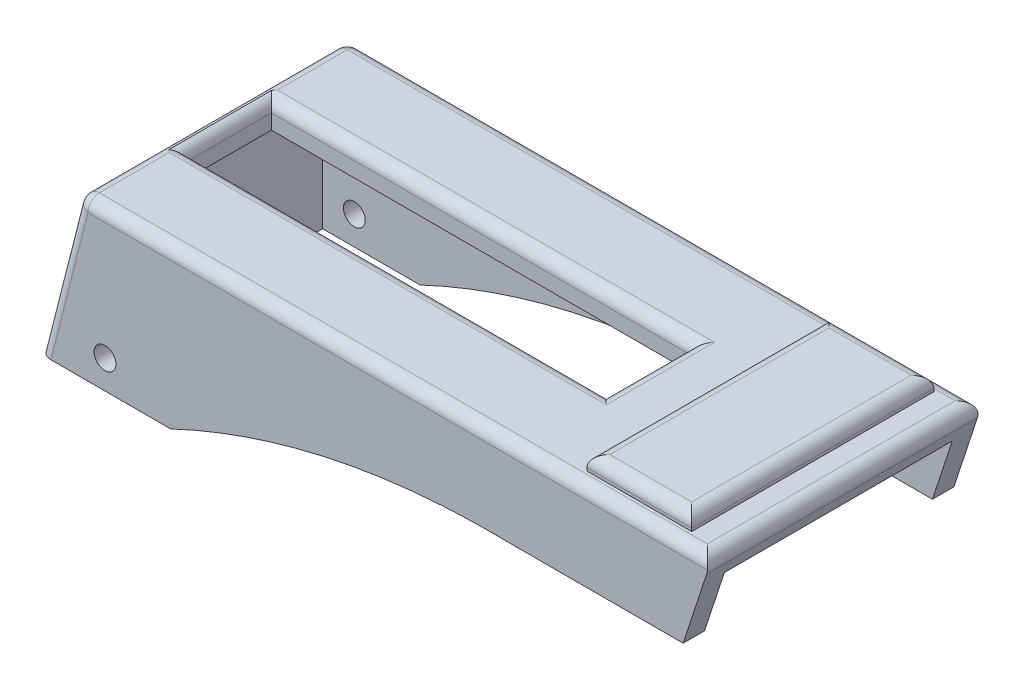
from build123d import *

# Parameters (mm, degrees)
SKETCH5_W           = 53.848
SKETCH5_H           = 14.0335
SKETCH5_W_2         = 9.3472
SKETCH5_H_2         = 1.27
BOSS_EXTRUDE2_DEPTH = 24.13
SKETCH7_R           = 0.97155
CUT_EXTRUDE3_DEPTH  = 40.748679545
SKETCH8_W           = 9.3472
SKETCH8_H           = 1.27
CUT_EXTRUDE4_DEPTH  = 1.27
SKETCH9_W           = 37.465
SKETCH9_H           = 7.62
CUT_EXTRUDE5_DEPTH  = 42.33069605
SKETCH10_W          = 56.896
SKETCH10_H          = 20.32
CUT_EXTRUDE6_DEPTH  = 11.684
FILLET1_R           = 1.016
FILLET5_R           = 1.016


with BuildPart() as part:
    # Sketch5 → Boss-Extrude2 (new body)
    with BuildSketch(Plane.XY):
        Rectangle(SKETCH5_W, SKETCH5_H)
        Polygon((26.924, 7.01675), (26.924, -0.71755), (29.464, 7.01675), align=None)
        Polygon((-26.924, 7.01675), (-30.48, -7.01675), (-26.924, -7.01675), align=None)
        with Locations((21.7424, 7.65175)):
            Rectangle(SKETCH5_W_2, SKETCH5_H_2)
    extrude(amount=BOSS_EXTRUDE2_DEPTH)

    # Sketch7 → Cut-Extrude3 (cut, through all)
    with BuildSketch(Plane.XY.offset(24.13)):
        with BuildLine():
            Line((26.924, -7.01675), (26.924, -0.71755))
            Line((26.924, -0.71755), (8.862620223, -0.71755))
            add(Edge.make_bspline(
                [(-18.7706, -7.01675), (-5.778401918, -0.891302623), (8.862620223, -0.71755)],
                knots=[0, 0, 0, 1, 1, 1], degree=2))
            Line((-18.7706, -7.01675), (26.924, -7.01675))
        make_face()
        with Locations((-24.6126, -4.47675)):
            Circle(SKETCH7_R)
    extrude(amount=-CUT_EXTRUDE3_DEPTH, mode=Mode.SUBTRACT)

    # Sketch8 → Cut-Extrude4 (cut)
    with BuildSketch(Plane(origin=(0, 8.28675, 0), x_dir=(1, 0, 0), z_dir=(0, 1, 0))):
        with Locations((21.7424, -0.635)):
            Rectangle(SKETCH8_W, SKETCH8_H)
        with Locations((21.7424, -23.495)):
            Rectangle(SKETCH8_W, SKETCH8_H)
    extrude(amount=-CUT_EXTRUDE4_DEPTH, mode=Mode.SUBTRACT)

    # Sketch9 → Cut-Extrude5 (cut, through all)
    with BuildSketch(Plane(origin=(0, 7.01675, 0), x_dir=(1, 0, 0), z_dir=(0, 1, 0))):
        with Locations((-6.9215, -12.065)):
            Rectangle(SKETCH9_W, SKETCH9_H)
    extrude(amount=-CUT_EXTRUDE5_DEPTH, mode=Mode.SUBTRACT)

    # Sketch10 → Cut-Extrude6 (cut)
    with BuildSketch(Plane.XZ.offset(7.01675)):
        with Locations((1.016, 12.065)):
            Rectangle(SKETCH10_W, SKETCH10_H)
    extrude(amount=-CUT_EXTRUDE6_DEPTH, mode=Mode.SUBTRACT)

    # Fillet1
    # the kernel refuses this fillet: 1.016 mm, written as the material it takes off along each edge
    with BuildSketch(Plane(origin=(-26.133337543, 6.00075, 1.016), x_dir=(-0.9693635135141576, 0.2456305735601486, 0), z_dir=(0, 0, -1))) as fillet1_piece_1_section:
        Polygon((0, 0), (FILLET1_R, 0), (FILLET1_R, FILLET1_R * 0.778211079665), (FILLET1_R * 0.24563057356, FILLET1_R * 0.969363513514), align=None)
    fillet1_piece_1 = extrude(amount=FILLET1_R, mode=Mode.PRIVATE)
    fillet1_piece_1 = fillet1_piece_1 - Plane(origin=(-26.133337543, 6.00075, 1.016), x_dir=(0.6141536560339975, -0.7891864714882498, 0), z_dir=(0, 0, -1)) * Sphere(FILLET1_R, mode=Mode.PRIVATE)
    add(fillet1_piece_1, mode=Mode.SUBTRACT)
    with BuildSketch(Plane(origin=(-26.133337543, 6.00075, 23.114), x_dir=(-0.9693635135141576, 0.2456305735601486, 0), z_dir=(0, 0, 1))) as fillet1_piece_2_section:
        Polygon((0, 0), (FILLET1_R, 0), (FILLET1_R, -FILLET1_R * 0.778211079665), (FILLET1_R * 0.24563057356, -FILLET1_R * 0.969363513514), align=None)
    fillet1_piece_2 = extrude(amount=FILLET1_R, mode=Mode.PRIVATE)
    fillet1_piece_2 = fillet1_piece_2 - Plane(origin=(-26.133337543, 6.00075, 23.114), x_dir=(0.6141536560339975, -0.7891864714882498, 0), z_dir=(0, 0, 1)) * Sphere(FILLET1_R, mode=Mode.PRIVATE)
    add(fillet1_piece_2, mode=Mode.SUBTRACT)
    with BuildSketch(Plane(origin=(-26.924, 7.01675, 1.016), x_dir=(-0.24563057356014745, -0.969363513514158, 0), z_dir=(0, 0, 1))) as fillet1_piece_3:
        with BuildLine():
            CenterArc((FILLET1_R * 0.778211079665, FILLET1_R), FILLET1_R, 194.219101718, 75.780898282)
            Line((-FILLET1_R * 0.191152433849, FILLET1_R * 0.75436942644), (0, 0))
            Line((0, 0), (FILLET1_R * 0.778211079665, 0))
        make_face()
    extrude(amount=22.098, mode=Mode.SUBTRACT)
    with BuildSketch(Plane(origin=(29.464, 7.01675, -3.507619048), x_dir=(-0.312012480499221, -0.9500780031201245, 0), z_dir=(0, 0, 1))) as fillet1_piece_4:
        with BuildLine():
            CenterArc((FILLET1_R * 1.38095238095, -FILLET1_R), FILLET1_R, 90, 108.180553842)
            Line((FILLET1_R * 0.430874377832, -FILLET1_R * 1.3120124805), (0, 0))
            Line((0, 0), (FILLET1_R * 1.38095238095, 0))
        make_face()
    extrude(amount=31.145238095, mode=Mode.SUBTRACT)
    with BuildSketch(Plane(origin=(32.004, 7.01675, 24.13), x_dir=(0, -1, 0), z_dir=(-1, 0, 0)), Plane(origin=(-26.133337543, 7.01675, 0), x_dir=(0, -1, 0), z_dir=(1, 0, 0))) as fillet1_piece_5:
        with BuildLine():
            CenterArc((FILLET1_R, -FILLET1_R), FILLET1_R, 90, 90)
            Line((0, -FILLET1_R), (0, 0))
            Line((0, 0), (FILLET1_R, 0))
        make_face()
    extrude(amount=58.137337543, mode=Mode.SUBTRACT)
    with BuildSketch(Plane(origin=(-27.118210873, 6.250310663, 24.13), x_dir=(0.9693635135141576, -0.24563057356014859, -3.4967654318902577e-15), z_dir=(-0.2456305735601486, -0.9693635135141576, 0)), Plane(origin=(-27.118210873, 6.250310663, 0), x_dir=(0, 0, 1), z_dir=(-0.2456305735601486, -0.9693635135141576, 0))) as fillet1_piece_6:
        with BuildLine():
            CenterArc((FILLET1_R, -FILLET1_R), FILLET1_R, 90, 90)
            Line((0, -FILLET1_R), (0, 0))
            Line((0, 0), (FILLET1_R, 0))
        make_face()
    extrude(amount=16.22636273, mode=Mode.SUBTRACT)
    with BuildSketch(Plane(origin=(11.811, 7.01675, 15.875), x_dir=(1, 0, 0), z_dir=(0, 0, -1)), Plane(origin=(-25.654, 7.01675, 8.255), x_dir=(-1, 0, 0), z_dir=(0, 0, 1))) as fillet1_piece_7:
        with BuildLine():
            CenterArc((FILLET1_R, FILLET1_R), FILLET1_R, 180, 90)
            Line((0, FILLET1_R), (0, 0))
            Line((0, 0), (FILLET1_R, 0))
        make_face()
    extrude(amount=7.62, mode=Mode.SUBTRACT)
    with BuildSketch(Plane(origin=(11.811, 7.01675, 8.255), x_dir=(0, 0, -1), z_dir=(-1, 0, 0)), Plane(origin=(-25.654, 7.01675, 15.875), x_dir=(0, 0, 1), z_dir=(1, 0, 0))) as fillet1_piece_8:
        with BuildLine():
            CenterArc((FILLET1_R, FILLET1_R), FILLET1_R, 180, 90)
            Line((0, FILLET1_R), (0, 0))
            Line((0, 0), (FILLET1_R, 0))
        make_face()
    extrude(amount=37.465, mode=Mode.SUBTRACT)
    with BuildSketch(Plane(origin=(11.811, 7.01675, 18.415), x_dir=(1, 0, 0), z_dir=(0, 0, -1))) as fillet1_piece_9a_section:
        with BuildLine():
            CenterArc((FILLET1_R, FILLET1_R), FILLET1_R, 180, 90)
            Line((0, FILLET1_R), (0, 0))
            Line((0, 0), (FILLET1_R, 0))
        make_face()
    fillet1_piece_9a = extrude(amount=10.16, mode=Mode.PRIVATE)
    fillet1_piece_9a = split(fillet1_piece_9a, bisect_by=Plane(origin=(12.041017436, 6.786732564, 15.875), z_dir=(0, 0, 1)), keep=Keep.TOP, mode=Mode.PRIVATE)
    with BuildSketch(Plane(origin=(-25.654, 7.01675, 15.875), x_dir=(0, 0, 1), z_dir=(1, 0, 0))) as fillet1_piece_9b_section:
        with BuildLine():
            CenterArc((FILLET1_R, FILLET1_R), FILLET1_R, 180, 90)
            Line((0, FILLET1_R), (0, 0))
            Line((0, 0), (FILLET1_R, 0))
        make_face()
    fillet1_piece_9b = extrude(amount=40.005, mode=Mode.PRIVATE)
    fillet1_piece_9b = split(fillet1_piece_9b, bisect_by=Plane(origin=(11.811, 6.786732564, 16.105017436), z_dir=(1, 0, 0)), keep=Keep.TOP, mode=Mode.PRIVATE)
    fillet1_piece_9 = fillet1_piece_9a & fillet1_piece_9b
    add(fillet1_piece_9, mode=Mode.SUBTRACT)
    with BuildSketch(Plane(origin=(14.351, 7.01675, 8.255), x_dir=(0, 0, -1), z_dir=(-1, 0, 0))) as fillet1_piece_10a_section:
        with BuildLine():
            CenterArc((FILLET1_R, FILLET1_R), FILLET1_R, 180, 90)
            Line((0, FILLET1_R), (0, 0))
            Line((0, 0), (FILLET1_R, 0))
        make_face()
    fillet1_piece_10a = extrude(amount=40.005, mode=Mode.PRIVATE)
    fillet1_piece_10a = split(fillet1_piece_10a, bisect_by=Plane(origin=(11.811, 6.786732564, 8.024982564), z_dir=(1, 0, 0)), keep=Keep.TOP, mode=Mode.PRIVATE)
    with BuildSketch(Plane(origin=(11.811, 7.01675, 15.875), x_dir=(1, 0, 0), z_dir=(0, 0, -1))) as fillet1_piece_10b_section:
        with BuildLine():
            CenterArc((FILLET1_R, FILLET1_R), FILLET1_R, 180, 90)
            Line((0, FILLET1_R), (0, 0))
            Line((0, 0), (FILLET1_R, 0))
        make_face()
    fillet1_piece_10b = extrude(amount=10.16, mode=Mode.PRIVATE)
    fillet1_piece_10b = split(fillet1_piece_10b, bisect_by=Plane(origin=(12.041017436, 6.786732564, 8.255), z_dir=(0, 0, -1)), keep=Keep.TOP, mode=Mode.PRIVATE)
    fillet1_piece_10 = fillet1_piece_10a & fillet1_piece_10b
    add(fillet1_piece_10, mode=Mode.SUBTRACT)
    with BuildSketch(Plane(origin=(-25.654, 7.01675, 5.715), x_dir=(-1, 0, 0), z_dir=(0, 0, 1))) as fillet1_piece_11a_section:
        with BuildLine():
            CenterArc((FILLET1_R, FILLET1_R), FILLET1_R, 180, 90)
            Line((0, FILLET1_R), (0, 0))
            Line((0, 0), (FILLET1_R, 0))
        make_face()
    fillet1_piece_11a = extrude(amount=10.16, mode=Mode.PRIVATE)
    fillet1_piece_11a = split(fillet1_piece_11a, bisect_by=Plane(origin=(-25.884017436, 6.786732564, 8.255), z_dir=(0, 0, -1)), keep=Keep.TOP, mode=Mode.PRIVATE)
    with BuildSketch(Plane(origin=(11.811, 7.01675, 8.255), x_dir=(0, 0, -1), z_dir=(-1, 0, 0))) as fillet1_piece_11b_section:
        with BuildLine():
            CenterArc((FILLET1_R, FILLET1_R), FILLET1_R, 180, 90)
            Line((0, FILLET1_R), (0, 0))
            Line((0, 0), (FILLET1_R, 0))
        make_face()
    fillet1_piece_11b = extrude(amount=40.005, mode=Mode.PRIVATE)
    fillet1_piece_11b = split(fillet1_piece_11b, bisect_by=Plane(origin=(-25.654, 6.786732564, 8.024982564), z_dir=(-1, 0, 0)), keep=Keep.TOP, mode=Mode.PRIVATE)
    fillet1_piece_11 = fillet1_piece_11a & fillet1_piece_11b
    add(fillet1_piece_11, mode=Mode.SUBTRACT)
    with BuildSketch(Plane(origin=(-25.654, 7.01675, 8.255), x_dir=(-1, 0, 0), z_dir=(0, 0, 1))) as fillet1_piece_12a_section:
        with BuildLine():
            CenterArc((FILLET1_R, FILLET1_R), FILLET1_R, 180, 90)
            Line((0, FILLET1_R), (0, 0))
            Line((0, 0), (FILLET1_R, 0))
        make_face()
    fillet1_piece_12a = extrude(amount=10.16, mode=Mode.PRIVATE)
    fillet1_piece_12a = split(fillet1_piece_12a, bisect_by=Plane(origin=(-25.884017436, 6.786732564, 15.875), z_dir=(0, 0, 1)), keep=Keep.TOP, mode=Mode.PRIVATE)
    with BuildSketch(Plane(origin=(-28.194, 7.01675, 15.875), x_dir=(0, 0, 1), z_dir=(1, 0, 0))) as fillet1_piece_12b_section:
        with BuildLine():
            CenterArc((FILLET1_R, FILLET1_R), FILLET1_R, 180, 90)
            Line((0, FILLET1_R), (0, 0))
            Line((0, 0), (FILLET1_R, 0))
        make_face()
    fillet1_piece_12b = extrude(amount=40.005, mode=Mode.PRIVATE)
    fillet1_piece_12b = split(fillet1_piece_12b, bisect_by=Plane(origin=(-25.654, 6.786732564, 16.105017436), z_dir=(-1, 0, 0)), keep=Keep.TOP, mode=Mode.PRIVATE)
    fillet1_piece_12 = fillet1_piece_12a & fillet1_piece_12b
    add(fillet1_piece_12, mode=Mode.SUBTRACT)

    # Fillet5
    fillet5_edges = [part.edges().sort_by_distance(p)[0] for p in [
        (26.416, 8.28675, 12.065),
        (17.0688, 8.28675, 12.065),
        (21.7424, 8.28675, 1.27),
        (21.7424, 8.28675, 22.86),
    ]]
    fillet(fillet5_edges, radius=FILLET5_R)


solid = part.part
